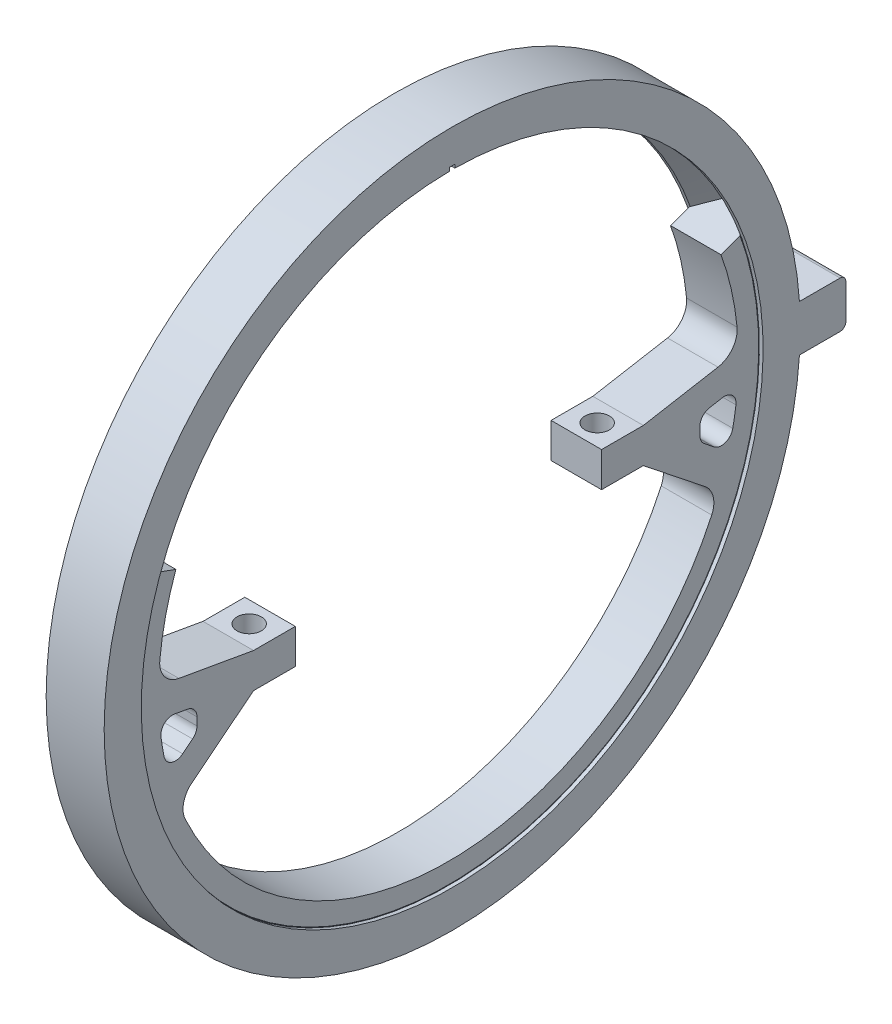
from build123d import *

# Parameters (mm, degrees)
REVOLVE2_ANGLE      = 110
BOSS_EXTRUDE1_START = -2.176469
BOSS_EXTRUDE1_DEPTH = 4.352938
FILLET1_R           = 2
FILLET2_R           = 1
CUT_EXTRUDE1_REACH  = 44.5
SKETCH4_R           = 1.05
SKETCH5_W           = 4
SKETCH5_H           = 4
BOSS_EXTRUDE2_DEPTH = 2.5
FILLET3_R           = 0.5
CUT_REVOLVE2_ANGLE  = 1


# Read off the part's stored shape, not the designer's step: Revolve2
with BuildPart() as part:
    # Sketch2 → Revolve1 (revolve)
    with BuildSketch(Plane(origin=(0, 0, 0), x_dir=(1, 0, 0), z_dir=(0, 1, 0)), mode=Mode.PRIVATE) as revolve1_sk:
        Polygon((-0.75, 28.5), (0, 28.5), (0, 30), (-2.5, 30), (-2.5, 26.8), (-2.176469373, 26.8), align=None)
    revolve1 = revolve(revolve1_sk.sketch.rotate(Axis((0, 0, 0), (1, 0, 0)), 180), axis=Axis((0, 0, 0), (1, 0, 0)))


with BuildPart() as body_2:
    # Revolve2 outline → Revolve2 (revolve)
    with BuildSketch(Plane(origin=(0, 0, 0), x_dir=(0, -1, 0), z_dir=(0, 0, 1))):
        Polygon((25, 0), (25, -2.176469373), (26.75, -2.176469373), (26.75, -2.15315399), (28.45, -0.726684617), (28.45, 0), align=None)
    revolve2 = revolve(axis=Axis((0, 0, 0), (1, 0, 0)), revolution_arc=REVOLVE2_ANGLE)


with BuildPart() as part_1:
    add(part.part)

    add(body_2.part)  # Mirror1 merges body 2
    # Mirror1: Revolve1, Revolve2 across plane
    add(revolve1.mirror(Plane(origin=(0, 0, 0), x_dir=(0, 0, 1), z_dir=(1, 0, 0))))
    add(revolve2.mirror(Plane(origin=(0, 0, 0), x_dir=(0, 0, 1), z_dir=(1, 0, 0))))

    # Sketch3 → Boss-Extrude1 (add)
    with BuildSketch(Plane(origin=(0, 0, 0), x_dir=(0, 0, -1), z_dir=(1, 0, 0)).offset(BOSS_EXTRUDE1_START)):
        with BuildLine():
            Line((24.992927205, 0.594634117), (16.8, -0.85))
            Line((16.8, -0.85), (13.2, -0.85))
            Line((13.2, -0.85), (13.2, -3.85))
            Line((13.2, -3.85), (16.8, -3.85))
            Line((16.8, -3.85), (23.314414659, -9.024304356))
            ThreePointArc((23.314414659, -9.024304356), (23.762509208, -7.768085746), (24.142970944, -6.489757623))
            Line((24.142970944, -6.489757623), (21.674472629, -4.529065489))
            Line((21.674472629, -4.529065489), (21.674472629, -2.529065489))
            Line((21.674472629, -2.529065489), (24.923348035, -1.956201097))
            ThreePointArc((24.923348035, -1.956201097), (24.990704742, -0.681671824), (24.992927205, 0.594634117))
        make_face()
    extrude(amount=BOSS_EXTRUDE1_DEPTH)

    # Fillet1
    # the kernel refuses this fillet: 2 mm, written as the material it adds along each edge
    with BuildSketch(Plane(origin=(-6.825018134, 0.594634117, -24.992927205), x_dir=(0, 0.9981410168670989, 0.06094678373395691), z_dir=(1, 0, 0))) as fillet1_piece_1_section:
        with BuildLine():
            CenterArc((1.785042868, 1.998616545), FILLET1_R, 186.505841055, 85.625388348)
            Line((-0.202077752, 1.772007538), (0, 0))
            ThreePointArc((0, 0), (0.929709827, -0.017293188), (1.859419654, 0))
        make_face()
    fillet1_piece_1 = extrude(amount=13.650036268, mode=Mode.PRIVATE)
    fillet1_piece_1 = split(fillet1_piece_1, bisect_by=Plane(origin=(-2.176469373, 0.943690029, -24.587007533), z_dir=(1, 0, 0)), keep=Keep.TOP, mode=Mode.PRIVATE)
    fillet1_piece_1 = split(fillet1_piece_1, bisect_by=Plane(origin=(2.176469373, 0.943690029, -24.587007533), z_dir=(-1, 0, 0)), keep=Keep.TOP, mode=Mode.PRIVATE)
    add(fillet1_piece_1)
    with BuildSketch(Plane(origin=(-6.138912646, -9.024304356, -23.314414659), x_dir=(0, -0.9206652582937426, 0.39035302249491577), z_dir=(1, 0, 0))) as fillet1_piece_2_section:
        with BuildLine():
            CenterArc((1.52157836, -1.998994886), FILLET1_R, 88.183445303, 76.333419365)
            Line((-0.405839783, -1.465085435), (0, 0))
            ThreePointArc((0, 0), (0.792488729, 0.012563925), (1.584977458, 0))
        make_face()
    fillet1_piece_2 = extrude(amount=12.277825292, mode=Mode.PRIVATE)
    fillet1_piece_2 = split(fillet1_piece_2, bisect_by=Plane(origin=(-2.176469373, -9.144329866, -22.922792538), z_dir=(1, 0, 0)), keep=Keep.TOP, mode=Mode.PRIVATE)
    fillet1_piece_2 = split(fillet1_piece_2, bisect_by=Plane(origin=(2.176469373, -9.144329866, -22.922792538), z_dir=(-1, 0, 0)), keep=Keep.TOP, mode=Mode.PRIVATE)
    add(fillet1_piece_2)

    # Fillet2
    fillet2_edges = [part_1.edges().sort_by_distance(p)[0] for p in [
        (0, -1.956201097, -24.923348035),
        (0, -2.529065489, -21.674472629),
        (0, -4.529065489, -21.674472629),
        (0, -6.489757623, -24.142970944),
    ]]
    fillet(fillet2_edges, radius=FILLET2_R)

    # Sketch4 → Cut-Extrude1 (cut, up to next)
    with BuildSketch(Plane(origin=(0, 0, 0), x_dir=(1, 0, 0), z_dir=(0, 1, 0)), mode=Mode.PRIVATE) as cut_extrude1_sk1:
        with Locations(Location((0, 15, 0), (0, 0, 270))):
            Circle(SKETCH4_R)
    cut_extrude1_tool1 = extrude(cut_extrude1_sk1.sketch, amount=-CUT_EXTRUDE1_REACH, mode=Mode.PRIVATE) & part_1.part
    add(cut_extrude1_tool1.solids().sort_by_distance((0, 0, -15))[0], mode=Mode.SUBTRACT)

    # Mirror2: part across plane


with BuildPart() as part_2:
    add(part_1.part)
    add(part_1.part.mirror(Plane.XY))

    # Sketch5 → Boss-Extrude2 (add, symmetric)
    with BuildSketch(Plane(origin=(0, 0, 0), x_dir=(0, 0, -1), z_dir=(1, 0, 0))):
        with Locations((31.933259094, 0)):
            Rectangle(SKETCH5_W, SKETCH5_H)
    extrude(amount=BOSS_EXTRUDE2_DEPTH, both=True)

    # Fillet3
    fillet3_edges = [part_2.edges().sort_by_distance(p)[0] for p in [
        (0, 2, -33.933259094),
        (0, -2, -33.933259094),
    ]]
    fillet(fillet3_edges, radius=FILLET3_R)

    # Sketch6 → Cut-Revolve2 (revolve, symmetric, cut)
    with BuildSketch(Plane.XY) as cut_revolve2_sk:
        Polygon((2.5, 27.1), (2.31636167, 27.1), (0.889892297, 28.8), (-0.889892297, 28.8), (-2.31636167, 27.1), (-2.5, 27.1), (-2.5, 26.8), (-2.176469373, 26.8), (-0.75, 28.5), (0.75, 28.5), (2.176469373, 26.8), (2.5, 26.8), align=None)
    revolve(axis=Axis((0, 0, 0), (1, 0, 0)), revolution_arc=CUT_REVOLVE2_ANGLE / 2, mode=Mode.SUBTRACT)
    revolve(cut_revolve2_sk.sketch, axis=Axis((0, 0, 0), (-1, 0, 0)), revolution_arc=CUT_REVOLVE2_ANGLE / 2, mode=Mode.SUBTRACT)


solid = part_2.part
